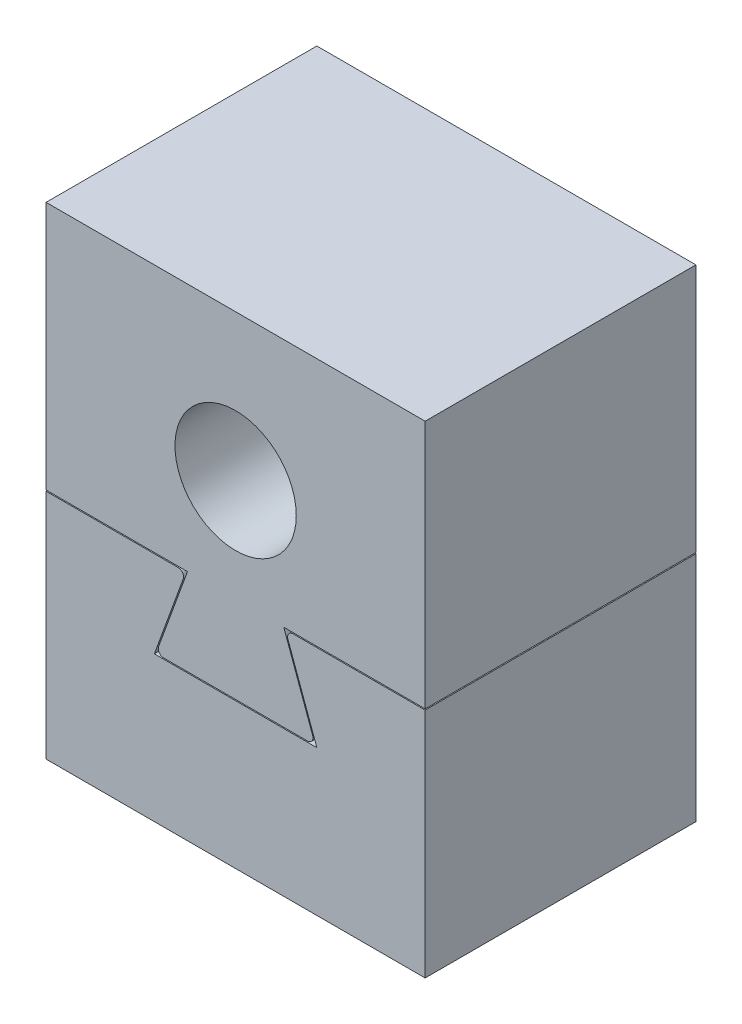
from build123d import *

# Parameters (mm, degrees)
SKETCH1_W                      = 35
SKETCH1_H                      = 44.52
SKETCH1_R                      = 5.6
BOSS_EXTRUDE1_DEPTH            = 25
CUT_EXTRUDE_THIN3_DEPTH        = 30.1
FILLET1_R                      = 0.5
FILLET2_R                      = 0.5
FILLET3_R                      = 0.5
FILLET4_R                      = 0.5
SKETCH6_W                      = 2.1
SKETCH6_H                      = 44.52
M5X0_8_TAPPED_HOLE1_AT_2_COUNT = 2
M5X0_8_TAPPED_HOLE1_AT_2_PITCH = 23
M5X0_8_START                   = -17.5
M5X0_8_TAPPED_HOLE2_OUTLINE_R  = 2.1
M5X0_8_TAPPED_HOLE2_DEPTH      = 12.668534181


# Read off the part's stored shape, not the designer's step: M5x0.8 Tapped Hole2
with BuildPart() as part:
    # Sketch1 → Boss-Extrude1 (new body)
    with BuildSketch(Plane.XY):
        with Locations((0, -8.76)):
            Rectangle(SKETCH1_W, SKETCH1_H)
        Circle(SKETCH1_R, mode=Mode.SUBTRACT)
    extrude(amount=BOSS_EXTRUDE1_DEPTH)

    # Sketch7 → Cut-Extrude-Thin3 (cut)
    with BuildSketch(Plane.XY.offset(25)):
        Polygon((-17.5, -9.6), (-4.588238126, -9.6), (-7.5, -17.6), (7.5, -17.6), (4.588238126, -9.6), (17.5, -9.6), (17.5, -9.5), (4.445423325, -9.5), (7.357185199, -17.5), (-7.357185199, -17.5), (-4.445423325, -9.5), (-17.5, -9.5), align=None)
    extrude(amount=-CUT_EXTRUDE_THIN3_DEPTH, mode=Mode.SUBTRACT)


with BuildPart() as cut_extrude_thin3_piece_1:
    # of the separate pieces the step leaves, piece 1, a body of its own (cut_extrude_thin3_pieces)
    add(part.part.solids().sort_by_distance((-17.5, 13.5, 0))[0])

    # Fillet1
    fillet1_edges = [cut_extrude_thin3_piece_1.edges().sort_by_distance(p)[0] for p in [
        (-7.357185199, -17.5, 12.5),
    ]]
    fillet(fillet1_edges, radius=FILLET1_R)

    # Fillet2
    fillet2_edges = [cut_extrude_thin3_piece_1.edges().sort_by_distance(p)[0] for p in [
        (7.357185199, -17.5, 12.5),
    ]]
    fillet(fillet2_edges, radius=FILLET2_R)


with BuildPart() as cut_extrude_thin3_piece_2:
    # of the separate pieces the step leaves, piece 2, a body of its own (cut_extrude_thin3_pieces)
    add(part.part.solids().sort_by_distance((-17.5, -31.02, 0))[0])

    # Fillet3
    fillet3_edges = [cut_extrude_thin3_piece_2.edges().sort_by_distance(p)[0] for p in [
        (4.588238126, -9.6, 12.5),
    ]]
    fillet(fillet3_edges, radius=FILLET3_R)

    # Fillet4
    fillet4_edges = [cut_extrude_thin3_piece_2.edges().sort_by_distance(p)[0] for p in [
        (-4.588238126, -9.6, 12.5),
    ]]
    fillet(fillet4_edges, radius=FILLET4_R)

    # Sketch6 → M5x0.8 Tapped Hole1 (revolve, cut)
    with BuildSketch(Plane(origin=(11.5, -31.02, 12.5), x_dir=(0, 0, -1), z_dir=(1, 0, 0))):
        with Locations((1.05, 22.26)):
            Rectangle(SKETCH6_W, SKETCH6_H)
    m5x0_8_tapped_hole1 = revolve(axis=Axis((11.5, -37.37, 12.5), (0, 1, 0)), mode=Mode.SUBTRACT)

    # M5x0.8 Tapped Hole1 at 2: M5x0.8 Tapped Hole1 ×2
    with Locations(*[(-i * M5X0_8_TAPPED_HOLE1_AT_2_PITCH, 0, 0) for i in range(1, M5X0_8_TAPPED_HOLE1_AT_2_COUNT)]):
        add(m5x0_8_tapped_hole1, mode=Mode.SUBTRACT)


with BuildPart() as m5x0_8_tapped_hole2_tool:
    # M5x0.8 Tapped Hole2 outline → M5x0.8 Tapped Hole2 (new body)
    with BuildSketch(Plane.YZ.offset(M5X0_8_START)):
        with Locations((-13.6, 6)):
            Circle(M5X0_8_TAPPED_HOLE2_OUTLINE_R)
        with Locations((-13.6, 19)):
            Circle(M5X0_8_TAPPED_HOLE2_OUTLINE_R)
    extrude(amount=M5X0_8_TAPPED_HOLE2_DEPTH)


with BuildPart() as cut_extrude_thin3_piece_1_1:
    add(cut_extrude_thin3_piece_1.part)

    # M5x0.8 Tapped Hole2: cut by m5x0_8_tapped_hole2_tool
    add(m5x0_8_tapped_hole2_tool.part, mode=Mode.SUBTRACT)


with BuildPart() as cut_extrude_thin3_piece_2_1:
    add(cut_extrude_thin3_piece_2.part)

    # M5x0.8 Tapped Hole2: cut by m5x0_8_tapped_hole2_tool
    add(m5x0_8_tapped_hole2_tool.part, mode=Mode.SUBTRACT)


solid = Compound([cut_extrude_thin3_piece_1_1.part, cut_extrude_thin3_piece_2_1.part])
